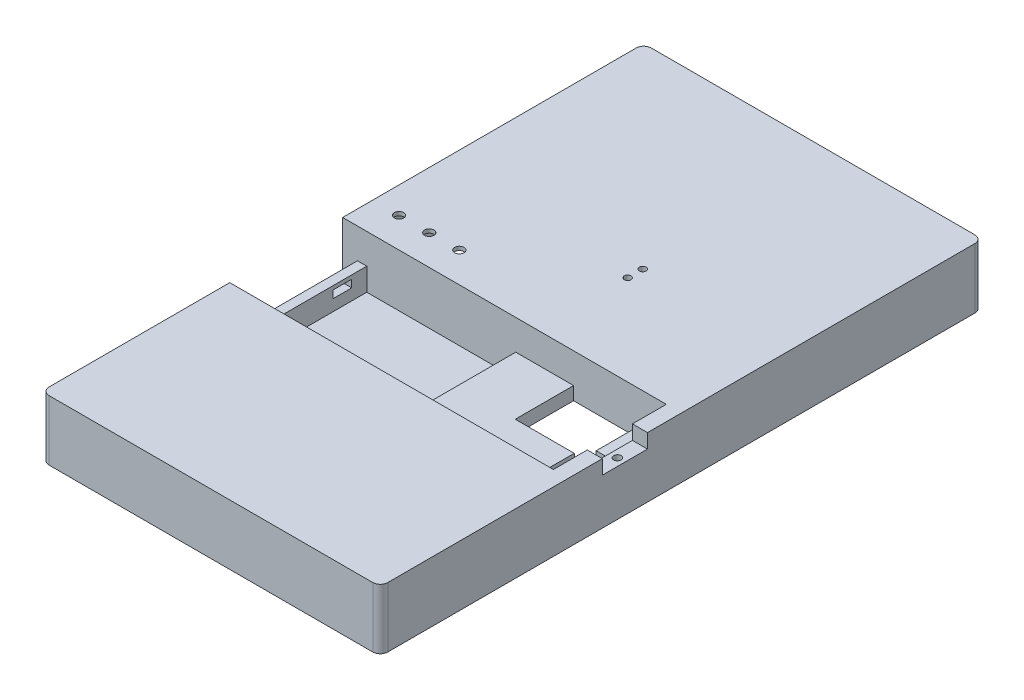
from build123d import *

# Parameters (mm, degrees)
SKETCH1_W            = 90
SKETCH1_H            = 160
BOSS_EXTRUDE1_DEPTH  = 15
SKETCH2_W            = 46
SKETCH2_H            = 30
CUT_EXTRUDE1_DEPTH   = 12
SKETCH3_W            = 44
SKETCH3_H            = 30
CUT_EXTRUDE2_DEPTH   = 8
SHELL1_START         = -47.6
SHELL1_OUTLINE_W     = 85.2
SHELL1_OUTLINE_H     = 13
SHELL1_DEPTH         = 45.2
SHELL1_START_2       = -157.6
SHELL1_2_OUTLINE_W   = 85.2
SHELL1_2_OUTLINE_H   = 5
SHELL1_2_DEPTH       = 75.2
SKETCH7_W            = 39
SKETCH7_H            = 34.8
CUT_EXTRUDE6_DEPTH   = 5
SKETCH11_W           = 42.056152249
SKETCH11_H           = 30
CUT_EXTRUDE9_DEPTH   = 2
CUT_EXTRUDE7_DEPTH   = 10
CUT_EXTRUDE10_DEPTH  = 3
SKETCH14_W           = 90
SKETCH14_H           = 160
SKETCH14_W_2         = 88.2
SKETCH14_H_2         = 158.2
BOSS_EXTRUDE2_DEPTH  = 1
SKETCH22_W           = 4
SKETCH22_H           = 30
BOSS_EXTRUDE6_DEPTH  = 8
SKETCH26_W           = 4
SKETCH26_H           = 12
CUT_EXTRUDE20_DEPTH  = 3.8
SKETCH27_R           = 1
CUT_EXTRUDE21_DEPTH  = 3
BOSS_EXTRUDE9_DEPTH  = 1.5
SKETCH40_R           = 4
CUT_EXTRUDE24_DEPTH  = 5
FILLET1_R            = 3
SKETCH44_W           = 85.2
SKETCH44_H           = 75.2
CUT_EXTRUDE25_DEPTH  = 9
SKETCH46_W           = 4.8
SKETCH46_H           = 15.6
BOSS_EXTRUDE15_DEPTH = 12.5
SKETCH6_R            = 0.9
CUT_EXTRUDE26_DEPTH  = 29.4
SKETCH47_W           = 33.8
SKETCH47_H           = 48
SKETCH47_W_2         = 6
SKETCH47_H_2         = 8
BOSS_EXTRUDE16_DEPTH = 12.5
SKETCH49_W           = 38.660197992
SKETCH49_H           = 10
SKETCH49_W_2         = 6
BOSS_EXTRUDE17_DEPTH = 11.5
CUT_EXTRUDE28_REACH  = 186.071
SKETCH50_W           = 22
SKETCH50_H           = 7
SKETCH50_W_2         = 20
SKETCH50_H_2         = 9
FILLET4_R            = 2
SKETCH51_R           = 1.5
CUT_EXTRUDE29_DEPTH  = 6
CUT_EXTRUDE30_DEPTH  = 3
SKETCH52_R           = 1
CUT_EXTRUDE31_DEPTH  = 3
SKETCH54_W           = 2.470433815
SKETCH54_H           = 30
BOSS_EXTRUDE18_DEPTH = 6
SKETCH55_W           = 5
SKETCH55_H           = 2
CUT_EXTRUDE32_DEPTH  = 3
FILLET5_R            = 1
SKETCH56_R           = 1.25
CUT_EXTRUDE33_DEPTH  = 3
SKETCH57_W           = 2.5
SKETCH57_H           = 8
BOSS_EXTRUDE19_DEPTH = 3
CUT_EXTRUDE36_REACH  = 186.071
SKETCH59_W           = 10.104623882
SKETCH59_H           = 32.567789254
SKETCH60_W           = 23.695376118
SKETCH60_H           = 48.017621291
CUT_EXTRUDE37_DEPTH  = 9.5
FILLET3_R            = 5


# Read off the part's stored shape, not the designer's step: Shell1
with BuildPart() as part:
    # Sketch1 → Boss-Extrude1 (new body)
    with BuildSketch(Plane(origin=(0, 0, 0), x_dir=(1, 0, 0), z_dir=(0, 1, 0))):
        with Locations((45, 80)):
            Rectangle(SKETCH1_W, SKETCH1_H)
    extrude(amount=BOSS_EXTRUDE1_DEPTH)

    # Sketch2 → Cut-Extrude1 (cut)
    with BuildSketch(Plane(origin=(0, 15, 0), x_dir=(1, 0, 0), z_dir=(0, 1, 0))):
        with Locations((23, 65)):
            Rectangle(SKETCH2_W, SKETCH2_H)
    extrude(amount=-CUT_EXTRUDE1_DEPTH, mode=Mode.SUBTRACT)

    # Sketch3 → Cut-Extrude2 (cut)
    with BuildSketch(Plane(origin=(0, 15, 0), x_dir=(1, 0, 0), z_dir=(0, 1, 0))):
        with Locations((68, 65)):
            Rectangle(SKETCH3_W, SKETCH3_H)
    extrude(amount=-CUT_EXTRUDE2_DEPTH, mode=Mode.SUBTRACT)

    # Shell1 outline → Shell1 (cut)
    with BuildSketch(Plane.XY.offset(SHELL1_START)):
        with Locations((45, 6.5)):
            Rectangle(SHELL1_OUTLINE_W, SHELL1_OUTLINE_H)
    extrude(amount=SHELL1_DEPTH, mode=Mode.SUBTRACT)

    # Shell1 2 outline → Shell1 2 (cut)
    with BuildSketch(Plane.XY.offset(SHELL1_START_2)):
        with Locations((45, 2.5)):
            Rectangle(SHELL1_2_OUTLINE_W, SHELL1_2_OUTLINE_H)
    extrude(amount=SHELL1_2_DEPTH, mode=Mode.SUBTRACT)

    # Sketch7 → Cut-Extrude6 (cut)
    with BuildSketch(Plane.XZ):
        with Locations((68.1, -65)):
            Rectangle(SKETCH7_W, SKETCH7_H)
    extrude(amount=-CUT_EXTRUDE6_DEPTH, mode=Mode.SUBTRACT)

    # Sketch11 → Cut-Extrude9 (cut)
    with BuildSketch(Plane(origin=(0, 3, 0), x_dir=(1, 0, 0), z_dir=(0, 1, 0))):
        with Locations((24.971923875, 65)):
            Rectangle(SKETCH11_W, SKETCH11_H)
    extrude(amount=-CUT_EXTRUDE9_DEPTH, mode=Mode.SUBTRACT)

    # Sketch8 → Cut-Extrude7 (cut)
    with BuildSketch(Plane.ZY.offset(-46)):
        Polygon((-63, 1), (-63, 2.5), (-75, 2.5), (-75, 4.5), (-63, 4.5), (-63, 6), (-52, 6), (-52, 4.5), (-52, 1), align=None)
    extrude(amount=-CUT_EXTRUDE7_DEPTH, mode=Mode.SUBTRACT)

    # Sketch12 → Cut-Extrude10 (cut)
    with BuildSketch(Plane(origin=(0, 7, 0), x_dir=(1, 0, 0), z_dir=(0, 1, 0))):
        Polygon((79.361885724, 68), (79.361885724, 80), (61.361885724, 80), (61.361885724, 64.5), (77.04695331, 64.5), (77.04695331, 51), (85.714801791, 51), (85.714801791, 68), align=None)
    extrude(amount=-CUT_EXTRUDE10_DEPTH, mode=Mode.SUBTRACT)

    # Sketch14 → Boss-Extrude2 (add)
    with BuildSketch(Plane.XZ):
        with Locations((45, -80)):
            Rectangle(SKETCH14_W, SKETCH14_H)
        with Locations((45, -80)):
            Rectangle(SKETCH14_W_2, SKETCH14_H_2, mode=Mode.SUBTRACT)
    extrude(amount=BOSS_EXTRUDE2_DEPTH)

    # Sketch22 → Boss-Extrude6 (add)
    with BuildSketch(Plane(origin=(0, 7, 0), x_dir=(1, 0, 0), z_dir=(0, 1, 0))):
        with Locations((88, 65)):
            Rectangle(SKETCH22_W, SKETCH22_H)
    extrude(amount=BOSS_EXTRUDE6_DEPTH)

    # Sketch26 → Cut-Extrude20 (cut)
    with BuildSketch(Plane(origin=(0, 15, 0), x_dir=(1, 0, 0), z_dir=(0, 1, 0))):
        with Locations((88, 65)):
            Rectangle(SKETCH26_W, SKETCH26_H)
    extrude(amount=-CUT_EXTRUDE20_DEPTH, mode=Mode.SUBTRACT)

    # Sketch27 → Cut-Extrude21 (cut)
    with BuildSketch(Plane(origin=(0, 11.2, 0), x_dir=(1, 0, 0), z_dir=(0, 1, 0))):
        with Locations(Location((88, 65, 0), (0, 0, 270))):
            Circle(SKETCH27_R)
    extrude(amount=-CUT_EXTRUDE21_DEPTH, mode=Mode.SUBTRACT)

    # Sketch36 → Boss-Extrude9 (add)
    with BuildSketch(Plane.XZ.offset(-5)):
        Polygon((77.04695331, -63.5), (60.361885724, -63.5), (60.361885724, -81), (80.361885724, -81), (80.361885724, -68), (79.361885724, -68), (79.361885724, -80), (61.361885724, -80), (61.361885724, -64.5), (77.04695331, -64.5), align=None)
    extrude(amount=BOSS_EXTRUDE9_DEPTH)

    # Sketch40 → Cut-Extrude24 (cut)
    with BuildSketch(Plane.ZY):
        with Locations((-140, 8)):
            Circle(SKETCH40_R)
    extrude(amount=-CUT_EXTRUDE24_DEPTH, mode=Mode.SUBTRACT)

    # Fillet1
    fillet1_edges = [part.edges().sort_by_distance(p)[0] for p in [
        (68.1, 5, -47.6),
    ]]
    fillet(fillet1_edges, radius=FILLET1_R)

    # Sketch44 → Cut-Extrude25 (cut)
    with BuildSketch(Plane.XZ.offset(-5)):
        with Locations((45, -120)):
            Rectangle(SKETCH44_W, SKETCH44_H)
    extrude(amount=-CUT_EXTRUDE25_DEPTH, mode=Mode.SUBTRACT)

    # Sketch46 → Boss-Extrude15 (add)
    with BuildSketch(Plane.XZ.offset(-14)):
        with Locations((51.4, -109.8)):
            Rectangle(SKETCH46_W, SKETCH46_H)
    extrude(amount=BOSS_EXTRUDE15_DEPTH)

    # Sketch6 → Cut-Extrude26 (cut)
    with BuildSketch(Plane(origin=(0, 15, 0), x_dir=(1, 0, 0), z_dir=(0, 1, 0))):
        with Locations(Location((51.75, 108, 0), (0, 0, 270))):
            Circle(SKETCH6_R)
        with Locations(Location((51.75, 104, 0), (0, 0, 270))):
            Circle(SKETCH6_R)
    extrude(amount=-CUT_EXTRUDE26_DEPTH, mode=Mode.SUBTRACT)

    # Sketch47 → Boss-Extrude16 (add)
    with BuildSketch(Plane.XZ.offset(-14)):
        with Locations((70.7, -133.6)):
            Rectangle(SKETCH47_W, SKETCH47_H)
        with Locations((5.4, -153.6)):
            Rectangle(SKETCH47_W_2, SKETCH47_H_2)
    extrude(amount=BOSS_EXTRUDE16_DEPTH)

    # Sketch49 → Boss-Extrude17 (add)
    with BuildSketch(Plane.XZ.offset(-13)):
        with Locations((68.269901004, -7.4)):
            Rectangle(SKETCH49_W, SKETCH49_H)
        with Locations((5.4, -7.4)):
            Rectangle(SKETCH49_W_2, SKETCH49_H)
    extrude(amount=BOSS_EXTRUDE17_DEPTH)

    # Cut-Extrude28: up to this face of the body (flat: up to its plane)
    cut_extrude28_end = Plane(part.part.faces().sort_by_distance((36.360749588, 14, -115.08476112))[0])
    # Sketch50 → Cut-Extrude28 (cut, up to the picked face)
    with BuildSketch(Plane.XZ.offset(-1.5), mode=Mode.PRIVATE) as cut_extrude28_sk1:
        with Locations((64.8, -113.1)):
            Rectangle(SKETCH50_W, SKETCH50_H)
    cut_extrude28_tool1 = split(extrude(cut_extrude28_sk1.sketch, amount=-CUT_EXTRUDE28_REACH, mode=Mode.PRIVATE), bisect_by=cut_extrude28_end, keep=Keep.BOTH, mode=Mode.PRIVATE)
    # Sketch50 → Cut-Extrude28 (cut, up to the picked face)
    with BuildSketch(Plane.XZ.offset(-1.5), mode=Mode.PRIVATE) as cut_extrude28_sk2:
        with Locations((64.939802008, -7.9)):
            Rectangle(SKETCH50_W_2, SKETCH50_H_2)
    cut_extrude28_tool2 = split(extrude(cut_extrude28_sk2.sketch, amount=-CUT_EXTRUDE28_REACH, mode=Mode.PRIVATE), bisect_by=cut_extrude28_end, keep=Keep.BOTH, mode=Mode.PRIVATE)
    add(cut_extrude28_tool1.solids().sort_by(Axis((64.8, 1.5, -113.1), (0, 1, 0)))[0], mode=Mode.SUBTRACT)
    add(cut_extrude28_tool2.solids().sort_by(Axis((64.939802, 1.5, -7.9), (0, 1, 0)))[0], mode=Mode.SUBTRACT)

    # Fillet4
    fillet4_edges = [part.edges().sort_by_distance(p)[0] for p in [
        (0, 7, -160),
        (90, 7, -160),
        (90, 7, 0),
        (0, 7, 0),
    ]]
    fillet(fillet4_edges, radius=FILLET4_R)

    # Sketch51 → Cut-Extrude29 (cut)
    with BuildSketch(Plane.XZ.offset(-1.5)):
        with Locations(Location((85, -155, 0), (0, 0, 270))):
            Circle(SKETCH51_R)
        with Locations(Location((85, -5, 0), (0, 0, 270))):
            Circle(SKETCH51_R)
        with Locations(Location((5, -5, 0), (0, 0, 270))):
            Circle(SKETCH51_R)
        with Locations(Location((5, -155, 0), (0, 0, 270))):
            Circle(SKETCH51_R)
    extrude(amount=-CUT_EXTRUDE29_DEPTH, mode=Mode.SUBTRACT)

    # Sketch53 → Cut-Extrude30 (cut)
    with BuildSketch(Plane.XZ.offset(-1.5)):
        Polygon((75.8, -109.6), (77.495376118, -109.6), (77.495376118, -157.6), (53.787002796, -157.6), (53.787002796, -110.656453849), (49, -110.656453849), (49, -102), (53.8, -102), (53.8, -116.6), (75.8, -116.6), align=None)
    extrude(amount=-CUT_EXTRUDE30_DEPTH, mode=Mode.SUBTRACT)

    # Sketch52 → Cut-Extrude31 (cut)
    with BuildSketch(Plane.XZ.offset(-1.5)):
        with Locations(Location((78.9, -6.622682824, 0), (0, 0, 270))):
            Circle(SKETCH52_R)
        with Locations(Location((51.19, -6.622682824, 0), (0, 0, 270))):
            Circle(SKETCH52_R)
        with Locations(Location((78.9, -112.202682824, 0), (0, 0, 270))):
            Circle(SKETCH52_R)
        with Locations(Location((51.19, -112.202682824, 0), (0, 0, 270))):
            Circle(SKETCH52_R)
    extrude(amount=-CUT_EXTRUDE31_DEPTH, mode=Mode.SUBTRACT)

    # Sketch54 → Boss-Extrude18 (add)
    with BuildSketch(Plane(origin=(0, 1, 0), x_dir=(1, 0, 0), z_dir=(0, 1, 0))):
        with Locations((5.179064659, 65)):
            Rectangle(SKETCH54_W, SKETCH54_H)
    extrude(amount=BOSS_EXTRUDE18_DEPTH)

    # Sketch55 → Cut-Extrude32 (cut)
    with BuildSketch(Plane.ZY.offset(-3.943847751)):
        with Locations((-73.5, 5)):
            Rectangle(SKETCH55_W, SKETCH55_H)
        with Locations((-56.5, 5)):
            Rectangle(SKETCH55_W, SKETCH55_H)
    extrude(amount=-CUT_EXTRUDE32_DEPTH, mode=Mode.SUBTRACT)

    # Fillet5
    fillet5_edges = [part.edges().sort_by_distance(p)[0] for p in [
        (25.5, 0, -82.4),
        (25.5, 0, -47.6),
    ]]
    fillet(fillet5_edges, radius=FILLET5_R)

    # Sketch56 → Cut-Extrude33 (cut)
    with BuildSketch(Plane(origin=(0, 15, 0), x_dir=(1, 0, 0), z_dir=(0, 1, 0))):
        with Locations(Location((7, 88, 0), (0, 0, 270))):
            Circle(SKETCH56_R)
        with Locations(Location((15, 88, 0), (0, 0, 270))):
            Circle(SKETCH56_R)
        with Locations(Location((23, 88, 0), (0, 0, 270))):
            Circle(SKETCH56_R)
    extrude(amount=-CUT_EXTRUDE33_DEPTH, mode=Mode.SUBTRACT)

    # Sketch57 → Boss-Extrude19 (add)
    with BuildSketch(Plane.XZ.offset(-14)):
        with Locations((3.65, -88.4)):
            Rectangle(SKETCH57_W, SKETCH57_H)
        with Locations((43.65, -88.4)):
            Rectangle(SKETCH57_W, SKETCH57_H)
    extrude(amount=BOSS_EXTRUDE19_DEPTH)

    # Cut-Extrude36: up to this face of the body (flat: up to its plane)
    cut_extrude36_end = Plane(part.part.faces().sort_by_distance((37.453503344, 14, -115.328530292))[0])
    # Sketch59 → Cut-Extrude36 (cut, up to the picked face)
    with BuildSketch(Plane.XZ.offset(-1.5), mode=Mode.PRIVATE) as cut_extrude36_sk1:
        with Locations((82.547688059, -133.39637261)):
            Rectangle(SKETCH59_W, SKETCH59_H)
    cut_extrude36_tool1 = split(extrude(cut_extrude36_sk1.sketch, amount=-CUT_EXTRUDE36_REACH, mode=Mode.PRIVATE), bisect_by=cut_extrude36_end, keep=Keep.BOTH, mode=Mode.PRIVATE)
    add(cut_extrude36_tool1.solids().sort_by(Axis((82.547688, 1.5, -133.396373), (0, 1, 0)))[0], mode=Mode.SUBTRACT)

    # Sketch60 → Cut-Extrude37 (cut)
    with BuildSketch(Plane.XZ.offset(-4.5)):
        with Locations((65.647688059, -133.591189355)):
            Rectangle(SKETCH60_W, SKETCH60_H)
    extrude(amount=-CUT_EXTRUDE37_DEPTH, mode=Mode.SUBTRACT)

    # Fillet3
    fillet3_edges = [part.edges().sort_by_distance(p)[0] for p in [
        (8.4, 7.75, -149.6),
        (8.4, 7.25, -12.4),
        (74.939802008, 7.25, -12.4),
        (77.495376118, 7.75, -149.680267237),
    ]]
    fillet(fillet3_edges, radius=FILLET3_R)


solid = part.part
